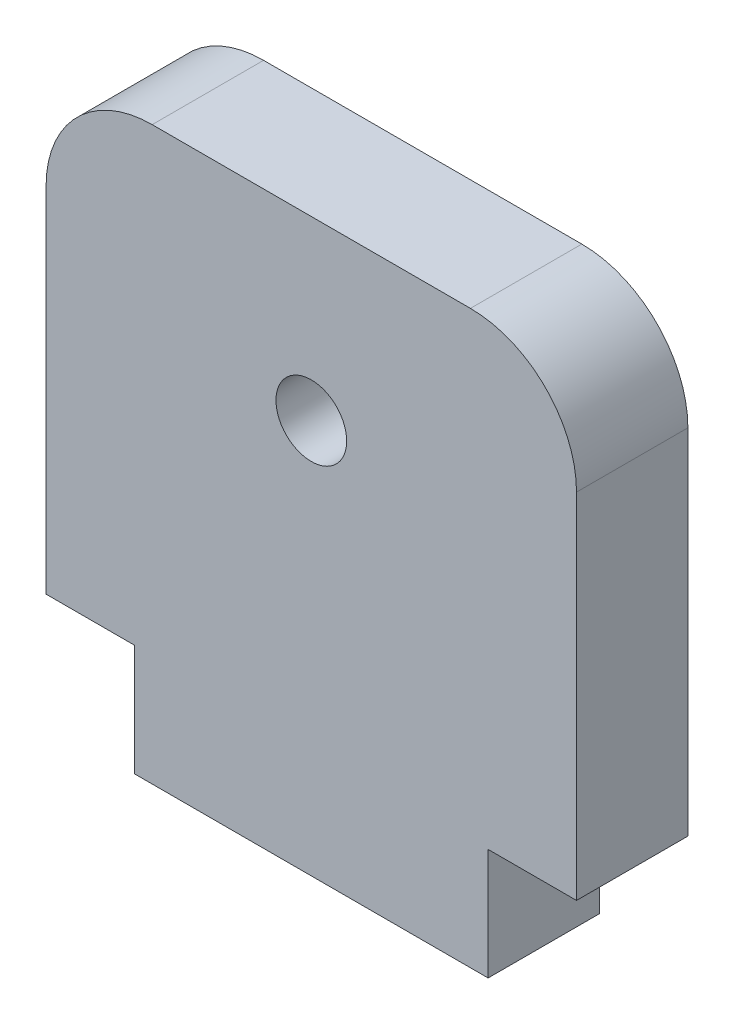
from build123d import *

# Parameters (mm, degrees)
SKETCH2_R           = 1.27
BOSS_EXTRUDE1_DEPTH = 4


with BuildPart() as part:
    # Sketch2 → Boss-Extrude1 (new body)
    with BuildSketch(Plane.XY):
        with BuildLine():
            Line((-9.525, -8.255), (-6.35, -8.255))
            Line((-6.35, -8.255), (-6.35, -12.255))
            Line((-6.35, -12.255), (6.35, -12.255))
            Line((6.35, -12.255), (6.35, -8.255))
            Line((6.35, -8.255), (9.525, -8.255))
            Line((9.525, -8.255), (9.525, 4.445))
            ThreePointArc((9.525, 4.445), (8.409076836, 7.139076836), (5.715, 8.255))
            Line((5.715, 8.255), (-5.715, 8.255))
            ThreePointArc((-5.715, 8.255), (-8.409076836, 7.139076836), (-9.525, 4.445))
            Line((-9.525, 4.445), (-9.525, -8.255))
        make_face()
        with Locations((0, 1.905)):
            Circle(SKETCH2_R, mode=Mode.SUBTRACT)
    extrude(amount=BOSS_EXTRUDE1_DEPTH)


solid = part.part
